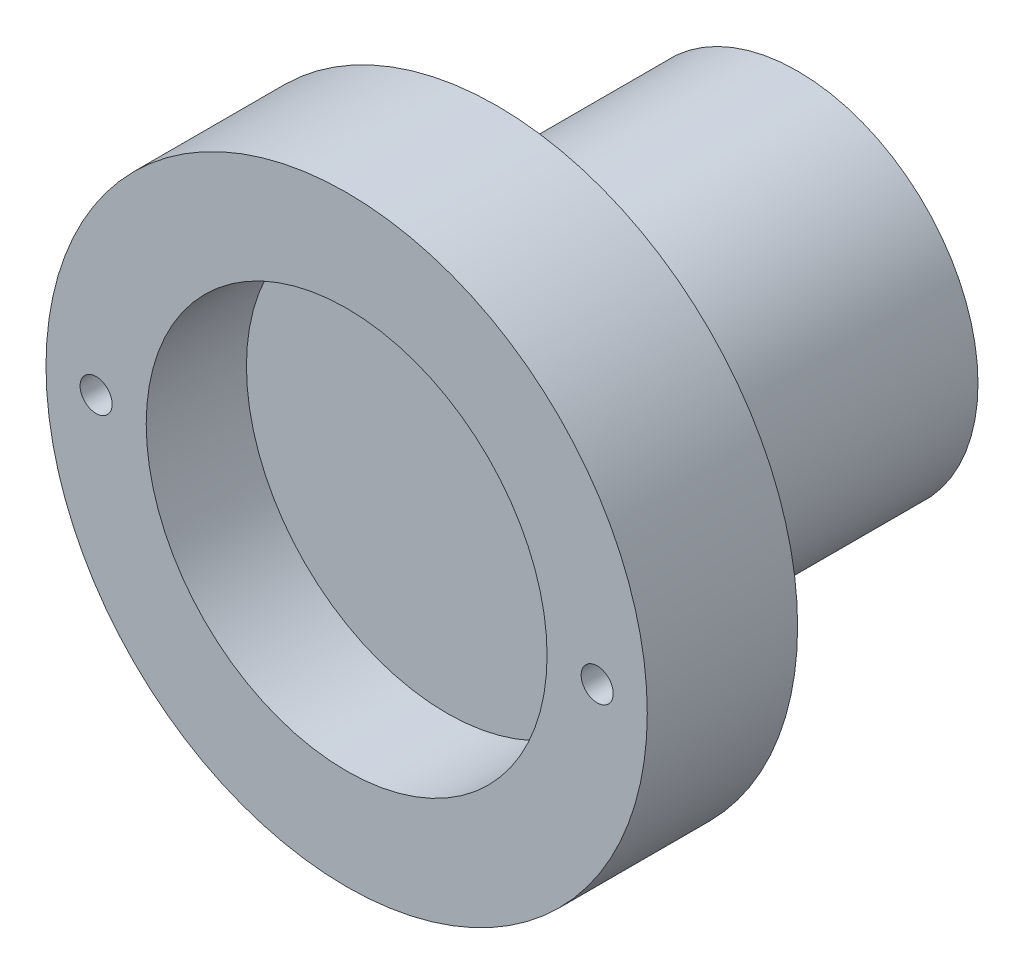
from build123d import *

# Parameters (mm, degrees)
SKETCH1_R           = 30
SKETCH1_R_2         = 1.6
BOSS_EXTRUDE1_DEPTH = 15
SKETCH2_R           = 20
CUT_EXTRUDE1_DEPTH  = 10
SKETCH3_R           = 18
BOSS_EXTRUDE2_DEPTH = 30
SKETCH4_R           = 16
CUT_EXTRUDE2_DEPTH  = 25


with BuildPart() as part:
    # Sketch1 → Boss-Extrude1 (new body)
    with BuildSketch(Plane.XY):
        Circle(SKETCH1_R)
        with Locations((-25, 0)):
            Circle(SKETCH1_R_2, mode=Mode.SUBTRACT)
        with Locations((25, 0)):
            Circle(SKETCH1_R_2, mode=Mode.SUBTRACT)
    extrude(amount=BOSS_EXTRUDE1_DEPTH)

    # Sketch2 → Cut-Extrude1 (cut)
    with BuildSketch(Plane.XY.offset(15)):
        Circle(SKETCH2_R)
    extrude(amount=-CUT_EXTRUDE1_DEPTH, mode=Mode.SUBTRACT)

    # Sketch3 → Boss-Extrude2 (add)
    with BuildSketch(Plane(origin=(0, 0, 0), x_dir=(-1, 0, 0), z_dir=(0, 0, -1))):
        Circle(SKETCH3_R)
    extrude(amount=BOSS_EXTRUDE2_DEPTH)

    # Sketch4 → Cut-Extrude2 (cut)
    with BuildSketch(Plane(origin=(0, 0, -30), x_dir=(-1, 0, 0), z_dir=(0, 0, -1))):
        Circle(SKETCH4_R)
    extrude(amount=-CUT_EXTRUDE2_DEPTH, mode=Mode.SUBTRACT)


solid = part.part
